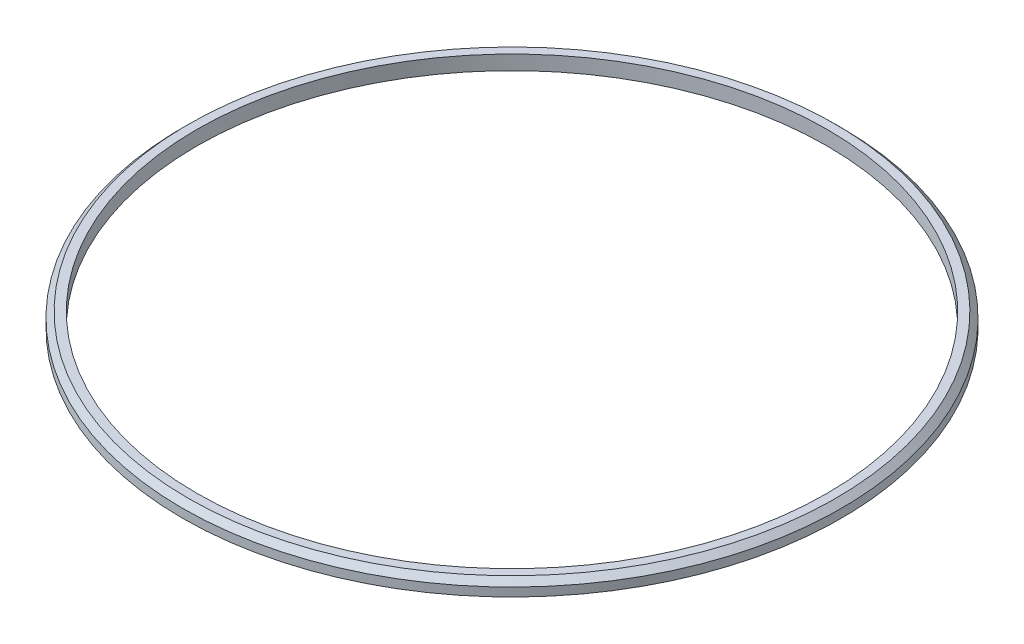
from build123d import *

# Parameters (mm, degrees)
SKETCH1_R           = 57.25
SKETCH1_R_2         = 54.75
BOSS_EXTRUDE1_DEPTH = 2.5
CHAMFER1_SIZE       = 1


with BuildPart() as part:
    # Sketch1 → Boss-Extrude1 (new body)
    with BuildSketch(Plane(origin=(0, 0, 0), x_dir=(1, 0, 0), z_dir=(0, 1, 0))):
        Circle(SKETCH1_R)
        Circle(SKETCH1_R_2, mode=Mode.SUBTRACT)
    extrude(amount=BOSS_EXTRUDE1_DEPTH)

    # Chamfer1
    chamfer1_edges = [part.edges().sort_by_distance(p)[0] for p in [
        (-57.25, 2.5, 0),
    ]]
    chamfer(chamfer1_edges, length=CHAMFER1_SIZE)


solid = part.part
